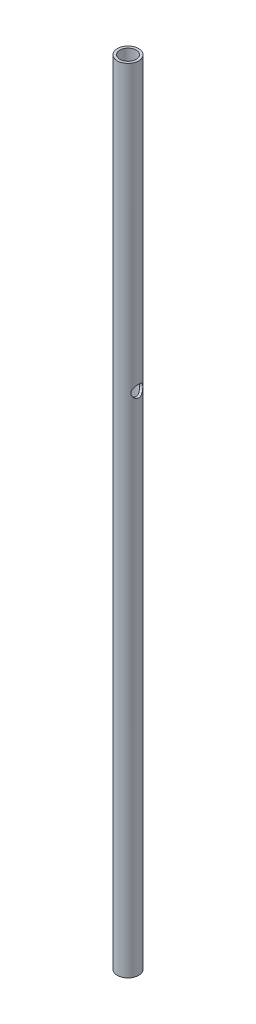
from build123d import *

# Parameters (mm, degrees)
STRUCTURE_SYSTEM1_OUTLINE_R   = 13.45
STRUCTURE_SYSTEM1_OUTLINE_R_2 = 10.25
STRUCTURE_SYSTEM1_DEPTH       = 1000
CUT_EXTRUDE1_DEPTH            = 1001.18088614
CUT_EXTRUDE1_DEPTH_BACK       = 1001.18088614
SKETCH12_R                    = 7.5


# Read off the part's stored shape, not the designer's step: Structure System1
with BuildPart() as part:
    # Structure System1 outline → Structure System1 (new body)
    with BuildSketch(Plane(origin=(0, 0, 0), x_dir=(1, 0, 0), z_dir=(0, 1, 0))):
        Circle(STRUCTURE_SYSTEM1_OUTLINE_R)
        Circle(STRUCTURE_SYSTEM1_OUTLINE_R_2, mode=Mode.SUBTRACT)
    extrude(amount=STRUCTURE_SYSTEM1_DEPTH)

    # Sketch12 → Cut-Extrude1 (cut, two sides: drawn at the far end of the back side and taken through both)
    with BuildSketch(Plane(origin=(0, 0, 0), x_dir=(0, 0, -1), z_dir=(1, 0, 0)).offset(-CUT_EXTRUDE1_DEPTH_BACK)):
        with Locations((0, 639.041378949)):
            Circle(SKETCH12_R)
    extrude(amount=CUT_EXTRUDE1_DEPTH + CUT_EXTRUDE1_DEPTH_BACK, mode=Mode.SUBTRACT)


solid = part.part
